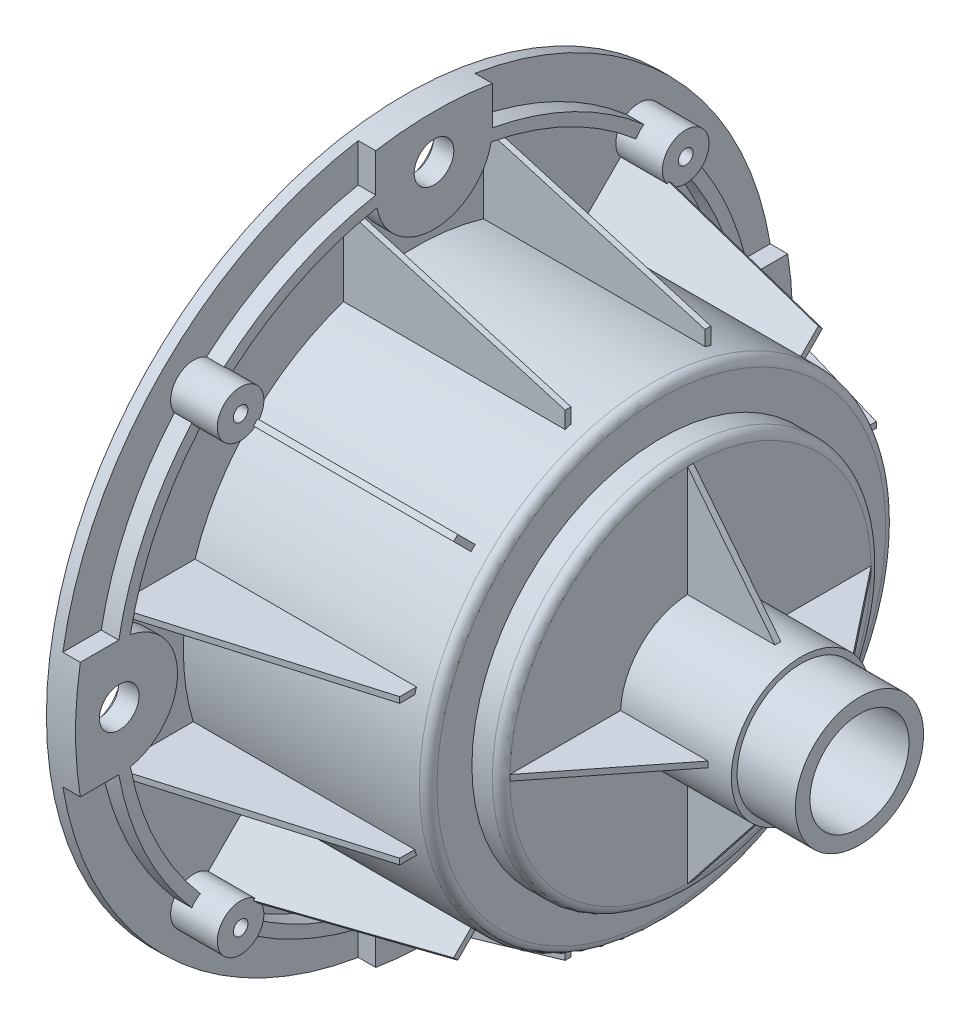
from build123d import *

# Parameters (mm, degrees)
SKETCH_1_R                      = 11
SKETCH_1_R_2                    = 8.5
EXTRUDE_1_DEPTH                 = 34
EXTRUDE_START                   = -10
SKETCH_2_R                      = 12
EXTRUDE_2_DEPTH                 = 19
SKETCH_5_R                      = 32.5
EXTRUDE_4_DEPTH                 = 2
FILLET_1_R                      = 1.5
CUT_EXTRUDE_1_DEPTH             = 91.000000044
CUT_EXTRUDE_1_DEPTH_BACK        = 91.000000044
SKETCH_8_R                      = 8.5
RIB_1_REACH                     = 99.98
SKETCH_9_WALL_W                 = 222.166616378
SKETCH_9_WALL_H                 = 1
PATTERN_CIRCULAR_1_COUNT        = 4
EXTRUDE_START_2                 = -4
SKETCH_10_R                     = 61.5
EXTRUDE_5_DEPTH                 = 2
CUT_EXTRUDE_2_REACH             = 118.827
SKETCH_11_R                     = 38
SKETCH_12_R                     = 55
SKETCH_12_R_2                   = 53
EXTRUDE_1_2_DEPTH               = 3
RIB_START                       = -0.5
RIB_6_DEPTH                     = 1
PATTERN_CIRCULAR_2_COUNT        = 4
PATTERN_START                   = -0.5
PATTERN_CIRCULAR_2_COPY_1_DEPTH = 1
PATTERN_CIRCULAR_2_COPY_2_DEPTH = 1
PATTERN_CIRCULAR_2_COPY_3_DEPTH = 1
RIB_7_DEPTH                     = 1
PATTERN_CIRCULAR_3_COUNT        = 4
EXTRUDE_6_DEPTH                 = 3
PATTERN_CIRCULAR_4_COUNT        = 4
EXTRUDE_7_DEPTH                 = 8
PATTERN_CIRCULAR_5_COUNT        = 4
SKETCH_23_R                     = 3.4
SKETCH_23_R_2                   = 1.25
CUT_EXTRUDE_3_DEPTH             = 116.501082246
PATTERN_CIRCULAR_6_COUNT        = 4
SKETCH_24_R                     = 5.25
CUT_EXTRUDE_4_DEPTH             = 1.5
PATTERN_CIRCULAR_7_COUNT        = 4
EXTRUDE_8_DEPTH                 = 3
PATTERN_CIRCULAR_8_COUNT        = 8


# Read off the part's stored shape, not the designer's step: 筋6, 筋7
with BuildPart() as part:
    # 草图1 → Extrude 1 (new body)
    with BuildSketch(Plane(origin=(0, 0, 0), x_dir=(0, 0, -1), z_dir=(1, 0, 0))):
        Circle(SKETCH_1_R)
        Circle(SKETCH_1_R_2, mode=Mode.SUBTRACT)
    extrude(amount=-EXTRUDE_1_DEPTH)

    # 草图2 → 凸台-拉伸2 (add)
    with BuildSketch(Plane(origin=(0, 0, 0), x_dir=(0, 0, -1), z_dir=(1, 0, 0)).offset(EXTRUDE_START)):
        Circle(SKETCH_2_R)
    extrude(amount=-EXTRUDE_2_DEPTH)

    # 草图5 → 凸台-拉伸4 (add)
    with BuildSketch(Plane.ZY.offset(29)):
        Circle(SKETCH_5_R)
    extrude(amount=EXTRUDE_4_DEPTH)

    # 草图7 → 旋转1 (revolve)
    with BuildSketch(Plane(origin=(0, 0, 0), x_dir=(1, 0, 0), z_dir=(0, 1, 0)), mode=Mode.PRIVATE) as revolve_1_sk:
        Polygon((-31, 32.5), (-34, 32.5), (-34, 40), (-80, 40), (-80, 38), (-36, 38), (-36, 30.5), (-31, 30.5), align=None)
    revolve(revolve_1_sk.sketch.rotate(Axis((-83.680758477, 0, 0), (1, 0, 0)), 180), axis=Axis((-83.680758477, 0, 0), (1, 0, 0)))

    # 圆角1
    fillet_1_edges = [part.edges().sort_by_distance(p)[0] for p in [
        (-29, 0, -32.5),
        (-34, 0, -40),
    ]]
    fillet(fillet_1_edges, radius=FILLET_1_R)

    # 草图8 → 切除-拉伸1 (cut, two sides: drawn at the far end of the back side and taken through both)
    with BuildSketch(Plane(origin=(-10, 0, 0), x_dir=(0, 0, -1), z_dir=(1, 0, 0)).offset(-CUT_EXTRUDE_1_DEPTH_BACK)):
        Circle(SKETCH_8_R)
    extrude(amount=CUT_EXTRUDE_1_DEPTH + CUT_EXTRUDE_1_DEPTH_BACK, mode=Mode.SUBTRACT)

    # 草图9 wall → 筋1 (add, up to next)
    with BuildSketch(Plane(origin=(-21.5, 21.5, 0), x_dir=(-0.619644288579, 0.784882765533, 0), z_dir=(-0.784882765533, -0.619644288579, 0)), mode=Mode.PRIVATE) as rib_1_sk1:
        Rectangle(SKETCH_9_WALL_W, SKETCH_9_WALL_H)
    rib_1_tool1 = extrude(rib_1_sk1.sketch, amount=RIB_1_REACH, mode=Mode.PRIVATE) - part.part
    rib_1 = rib_1_tool1.solids().sort_by_distance((-21.5, 21.5, 0))[0]
    add(rib_1)

    # 阵列(圆周)1: 筋1 ×4 about axis
    pattern_circular_1_axis = Axis((0, 0, 0), (1, 0, 0))
    for i in range(1, PATTERN_CIRCULAR_1_COUNT):
        add(rib_1.rotate(pattern_circular_1_axis, i * 360 / PATTERN_CIRCULAR_1_COUNT))

    # 草图10 → 凸台-拉伸5 (add)
    with BuildSketch(Plane.ZY.offset(80).offset(EXTRUDE_START_2)):
        Circle(SKETCH_10_R)
    extrude(amount=EXTRUDE_5_DEPTH)

    # 草图11 → 切除-拉伸2 (cut, up to next)
    with BuildSketch(Plane.ZY.offset(78), mode=Mode.PRIVATE) as cut_extrude_2_sk1:
        Circle(SKETCH_11_R)
    cut_extrude_2_tool1 = extrude(cut_extrude_2_sk1.sketch, amount=-CUT_EXTRUDE_2_REACH, mode=Mode.PRIVATE) & part.part
    add(cut_extrude_2_tool1.solids().sort_by_distance((-78, 0, 0))[0], mode=Mode.SUBTRACT)

    # 草图12 → Extrude 1 2 (add)
    with BuildSketch(Plane(origin=(-76, 0, 0), x_dir=(0, 0, -1), z_dir=(1, 0, 0))):
        Circle(SKETCH_12_R)
        Circle(SKETCH_12_R_2, mode=Mode.SUBTRACT)
    extrude(amount=EXTRUDE_1_2_DEPTH)

    # 筋6 outline → 筋6 (add)
    with BuildSketch(Plane(origin=(0, 12, 0), x_dir=(1, 0, 0), z_dir=(0, 1, 0)).offset(RIB_START)):
        Polygon((-38, 37), (-38, 40.879335746), (-75.102396864, 51.737317286), (-76, 51.999999999), (-76, 37), align=None)
    rib_6 = extrude(amount=RIB_6_DEPTH)

    # 镜向1: 筋6 across plane
    add(rib_6.mirror(Plane.ZX))

    # 阵列(圆周)2: 筋6 ×4 about axis
    pattern_circular_2_axis = Axis((0, 0, 0), (1, 0, 0))
    for i in range(1, PATTERN_CIRCULAR_2_COUNT):
        add(rib_6.rotate(pattern_circular_2_axis, i * 360 / PATTERN_CIRCULAR_2_COUNT))

    # 阵列(圆周)2 copy 1 sketch → 阵列(圆周)2 copy 1 (add)
    with BuildSketch(Plane(origin=(0, 0, -12), x_dir=(1, 0, 0), z_dir=(0, 0, -1)).offset(PATTERN_START)):
        Polygon((-38, -37), (-38, -40.879335746), (-75.102396864, -51.737317286), (-76, -51.999999999), (-76, -37), align=None)
    extrude(amount=PATTERN_CIRCULAR_2_COPY_1_DEPTH)

    # 阵列(圆周)2 copy 2 sketch → 阵列(圆周)2 copy 2 (add)
    with BuildSketch(Plane(origin=(0, 12, 0), x_dir=(1, 0, 0), z_dir=(0, 1, 0)).offset(PATTERN_START)):
        Polygon((-38, -37), (-38, -40.879335746), (-75.102396864, -51.737317286), (-76, -51.999999999), (-76, -37), align=None)
    extrude(amount=PATTERN_CIRCULAR_2_COPY_2_DEPTH)

    # 阵列(圆周)2 copy 3 sketch → 阵列(圆周)2 copy 3 (add)
    with BuildSketch(Plane.XY.offset(12).offset(PATTERN_START)):
        Polygon((-38, -37), (-38, -40.879335746), (-75.102396864, -51.737317286), (-76, -51.999999999), (-76, -37), align=None)
    extrude(amount=PATTERN_CIRCULAR_2_COPY_3_DEPTH)

    # 筋7 outline → 筋7 (add)
    with BuildSketch(Plane(origin=(0, 0, 0), x_dir=(0, -0.7071067811865513, 0.7071067811865437), z_dir=(0, 0.7071067811865437, 0.7071067811865513)).offset(RIB_START)):
        Polygon((-38, -38), (-44.246132044, -38), (-52, -76), (-38, -76), align=None)
    rib_7 = extrude(amount=RIB_7_DEPTH)

    # 阵列(圆周)3: 筋7 ×4 about axis
    pattern_circular_3_axis = Axis((0, 0, 0), (1, 0, 0))
    for i in range(1, PATTERN_CIRCULAR_3_COUNT):
        add(rib_7.rotate(pattern_circular_3_axis, i * 360 / PATTERN_CIRCULAR_3_COUNT))

    # 草图21 → 凸台-拉伸6 (add)
    with BuildSketch(Plane(origin=(-76, 0, 0), x_dir=(0, 0, -1), z_dir=(1, 0, 0))):
        with BuildLine():
            Line((-10, 60.681545794), (-10, 54.083269132))
            ThreePointArc((-10, 54.083269132), (0, 55), (10, 54.083269132))
            Line((10, 54.083269132), (10, 60.681545794))
            ThreePointArc((10, 60.681545794), (0, 61.5), (-10, 60.681545794))
        make_face()
        with BuildLine():
            ThreePointArc((9.814600801, 52.083333333), (0, 53), (-9.814600801, 52.083333333))
            ThreePointArc((-9.814600801, 52.083333333), (0, 44), (9.814600801, 52.083333333))
        make_face()
    extrude_6 = extrude(amount=EXTRUDE_6_DEPTH)

    # 阵列(圆周)4: 凸台-拉伸6 ×4 about axis
    pattern_circular_4_axis = Axis((0, 0, 0), (1, 0, 0))
    for i in range(1, PATTERN_CIRCULAR_4_COUNT):
        add(extrude_6.rotate(pattern_circular_4_axis, i * 360 / PATTERN_CIRCULAR_4_COUNT))

    # 草图22 → 凸台-拉伸7 (add)
    with BuildSketch(Plane(origin=(-76, 0, 0), x_dir=(0, 0, -1), z_dir=(1, 0, 0))):
        with BuildLine():
            ThreePointArc((-36.030555107, 41.554772274), (-41.012193309, 41.012193309), (-41.554772274, 36.030555107))
            ThreePointArc((-41.554772274, 36.030555107), (-38.890872965, 38.890872965), (-36.030555107, 41.554772274))
        make_face()
        with BuildLine():
            ThreePointArc((-40.905496147, 35.252523101), (-38.109679401, 34.184452349), (-35.355339059, 35.355339059))
            Line((-35.355339059, 35.355339059), (-38.183766184, 38.183766184))
            ThreePointArc((-38.183766184, 38.183766184), (-39.571781619, 36.743354494), (-40.905496147, 35.252523101))
        make_face()
        with BuildLine():
            Line((-38.183766184, 38.183766184), (-35.355339059, 35.355339059))
            ThreePointArc((-35.355339059, 35.355339059), (-34.488248054, 36.653032455), (-34.183766184, 38.183766184))
            ThreePointArc((-34.183766184, 38.183766184), (-34.460530204, 39.645790067), (-35.252523101, 40.905496147))
            ThreePointArc((-35.252523101, 40.905496147), (-36.743354494, 39.571781619), (-38.183766184, 38.183766184))
        make_face()
        with BuildLine():
            ThreePointArc((-40.905496147, 35.252523101), (-39.571781619, 36.743354494), (-38.183766184, 38.183766184))
            ThreePointArc((-38.183766184, 38.183766184), (-36.743354494, 39.571781619), (-35.252523101, 40.905496147))
            ThreePointArc((-35.252523101, 40.905496147), (-35.62089506, 41.254872109), (-36.030555107, 41.554772274))
            ThreePointArc((-36.030555107, 41.554772274), (-38.890872965, 38.890872965), (-41.554772274, 36.030555107))
            ThreePointArc((-41.554772274, 36.030555107), (-41.254872109, 35.62089506), (-40.905496147, 35.252523101))
        make_face()
    extrude_7 = extrude(amount=EXTRUDE_7_DEPTH)

    # 阵列(圆周)5: 凸台-拉伸7 ×4 about axis
    pattern_circular_5_axis = Axis((0, 0, 0), (1, 0, 0))
    for i in range(1, PATTERN_CIRCULAR_5_COUNT):
        add(extrude_7.rotate(pattern_circular_5_axis, i * 360 / PATTERN_CIRCULAR_5_COUNT))

    # 草图23 → 切除-拉伸3 (cut, symmetric)
    with BuildSketch(Plane(origin=(-76, 0, 0), x_dir=(0, 0, -1), z_dir=(1, 0, 0))):
        with Locations((0, 54)):
            Circle(SKETCH_23_R)
        with Locations((-38.183766184, 38.183766184)):
            Circle(SKETCH_23_R_2)
    cut_extrude_3 = extrude(amount=CUT_EXTRUDE_3_DEPTH, both=True, mode=Mode.SUBTRACT)

    # 阵列(圆周)6: 切除-拉伸3 ×4 about axis
    pattern_circular_6_axis = Axis((0, 0, 0), (1, 0, 0))
    for i in range(1, PATTERN_CIRCULAR_6_COUNT):
        add(cut_extrude_3.rotate(pattern_circular_6_axis, i * 360 / PATTERN_CIRCULAR_6_COUNT), mode=Mode.SUBTRACT)

    # 草图24 → 切除-拉伸4 (cut)
    with BuildSketch(Plane.ZY.offset(78)):
        with Locations((54, 0)):
            Circle(SKETCH_24_R)
    cut_extrude_4 = extrude(amount=-CUT_EXTRUDE_4_DEPTH, mode=Mode.SUBTRACT)

    # 阵列(圆周)7: 切除-拉伸4 ×4 about axis
    pattern_circular_7_axis = Axis((0, 0, 0), (1, 0, 0))
    for i in range(1, PATTERN_CIRCULAR_7_COUNT):
        add(cut_extrude_4.rotate(pattern_circular_7_axis, i * 360 / PATTERN_CIRCULAR_7_COUNT), mode=Mode.SUBTRACT)

    # 草图27 → 凸台-拉伸8 (add)
    with BuildSketch(Plane.ZY.offset(36)):
        with BuildLine():
            ThreePointArc((-1.499645516, 34.467391304), (-1.049067909, 33.427872899), (0, 33))
            Line((0, 33), (0, 34.5))
            ThreePointArc((0, 34.5), (-0.75, 34.491846863), (-1.499645516, 34.467391304))
        make_face()
        with BuildLine():
            Line((0, 34.5), (0, 33))
            ThreePointArc((0, 33), (1.049067909, 33.427872899), (1.499645516, 34.467391304))
            ThreePointArc((1.499645516, 34.467391304), (0.75, 34.491846863), (0, 34.5))
        make_face()
        with BuildLine():
            ThreePointArc((-1.499645516, 34.467391304), (-0.75, 34.491846863), (0, 34.5))
            Line((0, 34.5), (0, 36))
            ThreePointArc((0, 36), (-1.060660172, 35.560660172), (-1.5, 34.5))
            ThreePointArc((-1.5, 34.5), (-1.499911376, 34.483694689), (-1.499645516, 34.467391304))
        make_face()
        with BuildLine():
            Line((0, 36), (0, 34.5))
            ThreePointArc((0, 34.5), (0.75, 34.491846863), (1.499645516, 34.467391304))
            ThreePointArc((1.499645516, 34.467391304), (1.499911376, 34.483694689), (1.5, 34.5))
            ThreePointArc((1.5, 34.5), (1.060660172, 35.560660172), (0, 36))
        make_face()
        with BuildLine():
            Line((0, 38), (0, 36))
            ThreePointArc((0, 36), (1.060660172, 35.560660172), (1.5, 34.5))
            Line((1.5, 34.5), (1.5, 37.970383195))
            ThreePointArc((1.5, 37.970383195), (0.750146178, 37.992595077), (0, 38))
        make_face()
        with BuildLine():
            ThreePointArc((-1.5, 34.5), (-1.060660172, 35.560660172), (0, 36))
            Line((0, 36), (0, 38))
            ThreePointArc((0, 38), (-0.750146178, 37.992595077), (-1.5, 37.970383195))
            Line((-1.5, 37.970383195), (-1.5, 34.5))
        make_face()
    extrude_8 = extrude(amount=EXTRUDE_8_DEPTH)

    # 阵列(圆周)8: 凸台-拉伸8 ×8 about axis
    pattern_circular_8_axis = Axis((0, 0, 0), (1, 0, 0))
    for i in range(1, PATTERN_CIRCULAR_8_COUNT):
        add(extrude_8.rotate(pattern_circular_8_axis, i * 360 / PATTERN_CIRCULAR_8_COUNT))


solid = part.part
